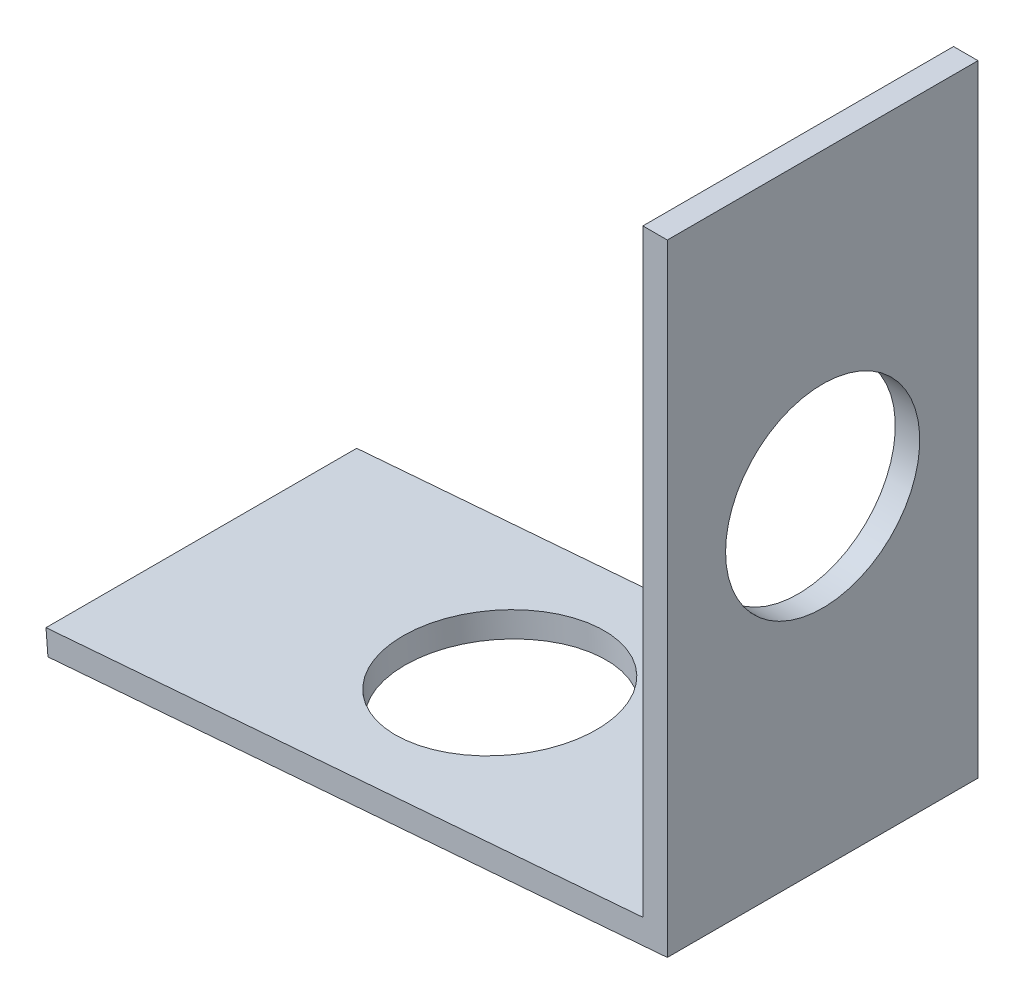
from build123d import *

# Parameters (mm, degrees)
BOSS_EXTRUDE1_DEPTH            = 6.35
F_5_16_0_3125_DIAMETER_HOLE1_D = 7.9375
F_5_16_0_3125_DIAMETER_HOLE2_D = 7.9375


with BuildPart() as part:
    # Sketch1 → Boss-Extrude1 (new, symmetric)
    with BuildSketch(Plane.XY):
        Polygon((0, 0), (0, 25.4), (-1, 25.4), (-1, 0.923419949), (-25.399102496, -1.022542132), (-25.319599474, -2.019376756), align=None)
    extrude(amount=BOSS_EXTRUDE1_DEPTH, both=True)

    # 5/16 (0.3125) Diameter Hole1 (through all)
    with Locations(Plane(origin=(-1, 13.161709974, 0), x_dir=(0, -1, 0), z_dir=(-1, 0, 0))):
        with Locations((0, 0)):
            Hole(F_5_16_0_3125_DIAMETER_HOLE1_D / 2)

    # 5/16 (0.3125) Diameter Hole2 (through all)
    with Locations(Plane(origin=(-13.199551248, -0.049561091, 0), x_dir=(0.996834624954, 0.079503021908, 0), z_dir=(-0.079503021908, 0.996834624954, 0))):
        with Locations((0, 0)):
            Hole(F_5_16_0_3125_DIAMETER_HOLE2_D / 2)


solid = part.part
